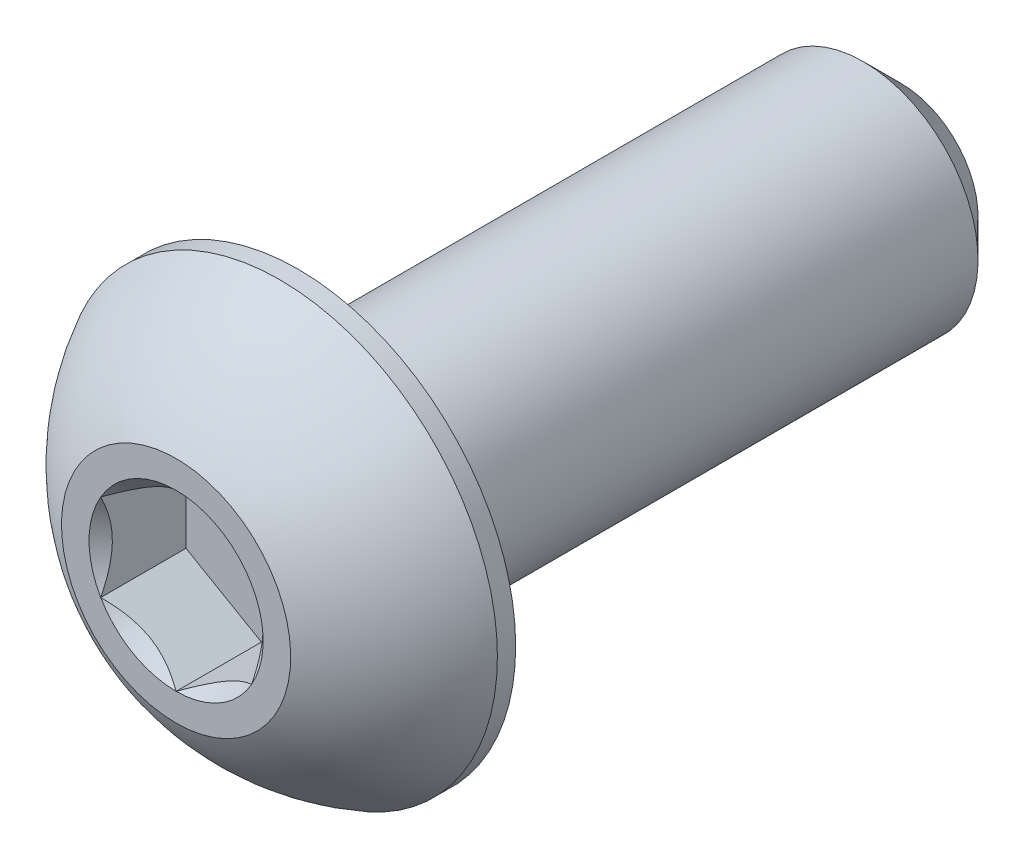
from build123d import *

# Parameters (mm, degrees)
SKETCH1_W          = 12.7
SKETCH1_H          = 2.413
CHAMFER1_SIZE      = 0.79375
CUT_EXTRUDE2_DEPTH = 1.79578
SKETCH6_R          = 1.833087105
CUT_EXTRUDE3_DEPTH = 1.79578
CUT_EXTRUDE3_TAPER = 45


with BuildPart() as part:
    # Sketch1 → Revolve1 (revolve)
    with BuildSketch(Plane(origin=(0, 0, 0), x_dir=(0, 0, -1), z_dir=(1, 0, 0))):
        with Locations((8.9154, 1.2065)):
            Rectangle(SKETCH1_W, SKETCH1_H)
    revolve(axis=Axis((0, 0, -15.2654), (0, 0, 1)))

    # Chamfer1
    chamfer1_edges = [part.edges().sort_by_distance(p)[0] for p in [
        (0, -2.413, -15.2654),
    ]]
    chamfer(chamfer1_edges, length=CHAMFER1_SIZE)

    # Sketch7 → Revolve2 (revolve)
    with BuildSketch(Plane(origin=(0, 0, 0), x_dir=(0, 0, -1), z_dir=(1, 0, 0))):
        with BuildLine():
            Line((2.18059, 4.5847), (2.5654, 4.5847))
            Line((2.5654, 4.5847), (2.5654, 0))
            Line((2.5654, 0), (0, 0))
            Line((0, 0), (0, 2.413))
            ThreePointArc((0, 2.413), (0.925030326, 3.664791196), (2.18059, 4.5847))
        make_face()
    revolve(axis=Axis((0, 0, 0), (0, 0, -1)))

    # Sketch5 → Cut-Extrude2 (cut)
    with BuildSketch(Plane.XY):
        Polygon((1.5875, -0.916543552), (1.5875, 0.916543552), (0, 1.833087105), (-1.5875, 0.916543552), (-1.5875, -0.916543552), (0, -1.833087105), align=None)
    extrude(amount=-CUT_EXTRUDE2_DEPTH, mode=Mode.SUBTRACT)

    # Sketch6 → Cut-Extrude3 (cut)
    with BuildSketch(Plane.XY):
        Circle(SKETCH6_R)
    extrude(amount=-CUT_EXTRUDE3_DEPTH, taper=CUT_EXTRUDE3_TAPER, mode=Mode.SUBTRACT)


solid = part.part
